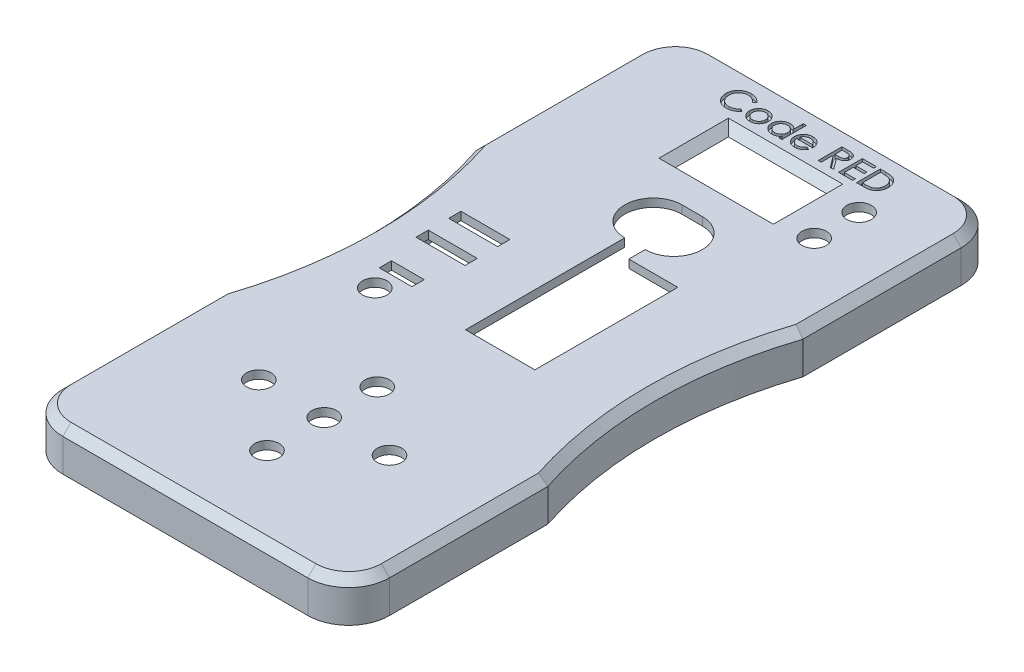
from build123d import *

# Parameters (mm, degrees)
SKETCH1_W           = 80
SKETCH1_H           = 160
BOSS_EXTRUDE1_DEPTH = 10
SKETCH2_R           = 100
CUT_EXTRUDE1_DEPTH  = 180.164728672
FILLET1_R           = 10
SHELL1_T            = -2
SKETCH3_R           = 4
BOSS_EXTRUDE2_DEPTH = 8
SKETCH4_R           = 2
BOSS_EXTRUDE3_DEPTH = 5
SKETCH5_R           = 3
CUT_EXTRUDE2_DEPTH  = 180.51323071
SKETCH7_R           = 3
SKETCH7_W           = 17
SKETCH7_H           = 35
SKETCH7_W_2         = 24
SKETCH7_H_2         = 13
SKETCH7_W_3         = 12
SKETCH7_H_3         = 3
SKETCH7_W_4         = 8
CUT_EXTRUDE3_DEPTH  = 180.51323071
CHAMFER1_SIZE       = 2
CHAMFER2_SIZE       = 2
CUT_EXTRUDE7_DEPTH  = 1
SKETCH14_R          = 3
CUT_EXTRUDE8_DEPTH  = 180.51323071
CUT_EXTRUDE9_REACH  = 181.165
SKETCH15_W          = 12
SKETCH15_H          = 8


with BuildPart() as part:
    # Sketch1 → Boss-Extrude1 (new body)
    with BuildSketch(Plane(origin=(0, 0, 0), x_dir=(1, 0, 0), z_dir=(0, 1, 0))):
        with Locations((40, 80)):
            Rectangle(SKETCH1_W, SKETCH1_H)
    extrude(amount=BOSS_EXTRUDE1_DEPTH)

    # Sketch2 → Cut-Extrude1 (cut, through all)
    with BuildSketch(Plane(origin=(0, 10, 0), x_dir=(1, 0, 0), z_dir=(0, 1, 0))):
        with Locations((-95, 80)):
            Circle(SKETCH2_R)
        with Locations((175, 80)):
            Circle(SKETCH2_R)
    extrude(amount=-CUT_EXTRUDE1_DEPTH, mode=Mode.SUBTRACT)

    # Fillet1
    fillet1_edges = [part.edges().sort_by_distance(p)[0] for p in [
        (0, 5, -160),
        (80, 5, -160),
        (80, 5, 0),
        (0, 5, 0),
    ]]
    fillet(fillet1_edges, radius=FILLET1_R)

    # Shell1
    shell1_openings = [part.faces().sort_by_distance(p)[0] for p in [
        (40, 0, -80),
    ]]
    offset(amount=SHELL1_T, openings=shell1_openings, kind=Kind.INTERSECTION)

    # Sketch3 → Boss-Extrude2 (add, through all)
    with BuildSketch(Plane.XZ.offset(-8)):
        with Locations(Location((70, -150, 0), (0, 0, 270))):
            Circle(SKETCH3_R)
        with Locations(Location((10, -150, 0), (0, 0, 90))):
            Circle(SKETCH3_R)
        with Locations(Location((10, -10, 0), (0, 0, 270))):
            Circle(SKETCH3_R)
        with Locations(Location((70, -10, 0), (0, 0, 90))):
            Circle(SKETCH3_R)
    extrude(amount=BOSS_EXTRUDE2_DEPTH)

    # Sketch4 → Boss-Extrude3 (add)
    with BuildSketch(Plane.XZ):
        with Locations(Location((70, -150, 0), (0, 0, 270))):
            Circle(SKETCH4_R)
        with Locations(Location((10, -150, 0), (0, 0, 90))):
            Circle(SKETCH4_R)
        with Locations(Location((10, -10, 0), (0, 0, 270))):
            Circle(SKETCH4_R)
        with Locations(Location((70, -10, 0), (0, 0, 90))):
            Circle(SKETCH4_R)
    extrude(amount=BOSS_EXTRUDE3_DEPTH)

    # Sketch5 → Cut-Extrude2 (cut, through all)
    with BuildSketch(Plane(origin=(0, 10, 0), x_dir=(1, 0, 0), z_dir=(0, 1, 0))):
        with Locations(Location((40, 47, 0), (0, 0, 270))):
            Circle(SKETCH5_R)
        with Locations(Location((24, 34, 0), (0, 0, 270))):
            Circle(SKETCH5_R)
        with Locations(Location((40, 20, 0), (0, 0, 270))):
            Circle(SKETCH5_R)
        with Locations(Location((56, 34, 0), (0, 0, 270))):
            Circle(SKETCH5_R)
        with Locations(Location((40, 34, 0), (0, 0, 270))):
            Circle(SKETCH5_R)
    extrude(amount=-CUT_EXTRUDE2_DEPTH, mode=Mode.SUBTRACT)

    # Sketch7 → Cut-Extrude3 (cut, through all)
    with BuildSketch(Plane(origin=(0, 10, 0), x_dir=(1, 0, 0), z_dir=(0, 1, 0))):
        with Locations(Location((18.7, 67.7, 0), (0, 0, 270))):
            Circle(SKETCH7_R)
        with Locations((47.19, 87.42)):
            Rectangle(SKETCH7_W, SKETCH7_H)
        with Locations((40, 138.5)):
            Rectangle(SKETCH7_W_2, SKETCH7_H_2)
        with Locations((19, 85)):
            Rectangle(SKETCH7_W_3, SKETCH7_H_3)
        with Locations((19, 93)):
            Rectangle(SKETCH7_W_3, SKETCH7_H_3)
        with Locations((19, 74)):
            Rectangle(SKETCH7_W_4, SKETCH7_H_3)
    extrude(amount=-CUT_EXTRUDE3_DEPTH, mode=Mode.SUBTRACT)

    # Chamfer1
    chamfer1_edges = [part.edges().sort_by_distance(p)[0] for p in [
        (52, 10, -138.5),
        (40, 10, -132),
        (28, 10, -138.5),
        (40, 10, -145),
    ]]
    chamfer(chamfer1_edges, length=CHAMFER1_SIZE - 0.0001)  # a hair under: the kernel refuses the full size

    # Chamfer2
    chamfer2_edges = [part.edges().sort_by_distance(p)[0] for p in [
        (0, 10, -29.387505004),
        (80, 10, -130.612494996),
        (5, 10, -80),
        (75, 10, -80),
        (80, 10, -29.387505004),
        (40, 10, 0),
        (0, 10, -130.612494996),
        (40, 10, -160),
        (77.071067812, 10, -157.071067812),
        (2.928932188, 10, -157.071067812),
        (2.928932188, 10, -2.928932188),
        (77.071067812, 10, -2.928932188),
    ]]
    chamfer(chamfer2_edges, length=CHAMFER2_SIZE)

    # Sketch13 → Cut-Extrude7 (cut)
    # profile 1 of 7: a face of its own
    with BuildSketch(Plane(origin=(0, 10, 0), x_dir=(1, 0, 0), z_dir=(0, 1, 0))):
        with BuildLine():
            Line((26.193963675, 153.738755342), (25.599287193, 153.328311966))
            add(Edge.make_bspline(
                [(25.599287193, 153.328311966), (25.528062162, 153.406328406), (25.388630662, 153.559054902), (25.159021422, 153.759117189), (24.918725731, 153.927500972), (24.66740523, 154.063645656), (24.404793831, 154.170225373), (24.129510174, 154.24428046), (23.841266656, 154.289918939), (23.644799324, 154.29557183), (23.544738248, 154.298450855)],
                knots=[0, 0, 0, 0, 1.078723025, 2.111729107, 3.104379151, 4.071093171, 5.02612831, 5.993405043, 6.978038489, 8, 8, 8, 8], degree=3))
            add(Edge.make_bspline(
                [(23.544738248, 154.298450855), (23.492610969, 154.297699506), (23.388908978, 154.296204772), (23.235234842, 154.279771223), (23.083911262, 154.257278281), (22.935080612, 154.223102576), (22.789007291, 154.178424225), (22.644696025, 154.126610921), (22.504332235, 154.062434982), (22.366554285, 153.991103828), (22.233429412, 153.910872088), (22.108037607, 153.821760448), (21.988097535, 153.727750735), (21.877000096, 153.624398163), (21.773731438, 153.513516606), (21.676029431, 153.396501414), (21.586363494, 153.271830551), (21.50507827, 153.139877771), (21.430933715, 153.00260913), (21.368710518, 152.859018576), (21.314689006, 152.711542005), (21.269858432, 152.559411486), (21.236701434, 152.402166218), (21.212115983, 152.240234224), (21.19636083, 152.073974182), (21.194802759, 151.961368517), (21.194017094, 151.904586505)],
                knots=[0, 0, 0, 0, 1.002068956, 1.993515617, 2.969284448, 3.943018425, 4.926742606, 5.905741285, 6.889351865, 7.892340394, 8.888397413, 9.875523532, 10.849114049, 11.817064186, 12.790109362, 13.76151668, 14.746886598, 15.740472426, 16.740336546, 17.744438579, 18.747064952, 19.759451636, 20.791569268, 21.834966327, 22.908270136, 24, 24, 24, 24], degree=3))
            add(Edge.make_bspline(
                [(21.194017094, 151.904586505), (21.195815801, 151.819350291), (21.199336826, 151.652497814), (21.233369471, 151.408183811), (21.286472412, 151.175361077), (21.361119129, 150.954047997), (21.45757153, 150.744495985), (21.575572883, 150.54704931), (21.715802202, 150.36122654), (21.875934798, 150.189429572), (22.050494454, 150.031764282), (22.2396856, 149.896867612), (22.437029697, 149.779727631), (22.646427088, 149.68671957), (22.864918821, 149.612748892), (23.094195898, 149.56035091), (23.333546111, 149.528201242), (23.496829514, 149.524341732), (23.579719217, 149.522382479)],
                knots=[0, 0, 0, 0, 1.083728652, 2.12143175, 3.131304262, 4.117911469, 5.086904967, 6.060353746, 7.03835, 8.042493243, 9.043967071, 10.025107856, 10.993520914, 11.958418665, 12.934074928, 13.923564625, 14.94591178, 16, 16, 16, 16], degree=3))
            add(Edge.make_bspline(
                [(23.579719217, 149.522382479), (23.675907104, 149.525209949), (23.865884359, 149.530794385), (24.145222271, 149.577832333), (24.414371359, 149.653806927), (24.673622222, 149.76090741), (24.923186463, 149.898081429), (25.161891676, 150.066383706), (25.391068223, 150.264292369), (25.530369152, 150.41528907), (25.601619257, 150.492521368)],
                knots=[0, 0, 0, 0, 0.996377973, 1.967910503, 2.926842387, 3.889624876, 4.868586907, 5.872161968, 6.91164629, 8, 8, 8, 8], degree=3))
            Line((25.601619257, 150.492521368), (26.193963675, 150.084410056))
            add(Edge.make_bspline(
                [(26.193963675, 150.084410056), (26.155617836, 150.035781041), (26.079429641, 149.93916151), (25.956391403, 149.802496932), (25.827155165, 149.673964436), (25.690448282, 149.55475624), (25.546417014, 149.444988292), (25.395736213, 149.343389595), (25.238550675, 149.250121746), (25.074946275, 149.166182775), (24.905855053, 149.091056315), (24.730931778, 149.027791039), (24.551852914, 148.9719807), (24.367039443, 148.928287383), (24.177212833, 148.892875179), (23.982079084, 148.869106306), (23.782491433, 148.853018596), (23.647770285, 148.851509929), (23.579719217, 148.850747863)],
                knots=[0, 0, 0, 0, 0.990136069, 1.967271632, 2.938597646, 3.903378639, 4.8655934, 5.832714132, 6.808088679, 7.786607084, 8.77175572, 9.76479442, 10.759640537, 11.769709565, 12.799869661, 13.846050076, 14.911985293, 16, 16, 16, 16], degree=3))
            add(Edge.make_bspline(
                [(23.579719217, 148.850747863), (23.517113544, 148.851172144), (23.393706408, 148.852008478), (23.211329218, 148.866060433), (23.033784929, 148.885061935), (22.861552108, 148.913568804), (22.693818044, 148.94770619), (22.53195184, 148.992968296), (22.373757426, 149.043457424), (22.221536542, 149.10451697), (22.074141449, 149.172418182), (21.93105363, 149.246836731), (21.793680783, 149.330803997), (21.661908557, 149.423504444), (21.534185896, 149.522604406), (21.411804571, 149.630310378), (21.29349124, 149.745250814), (21.220314619, 149.828169944), (21.183522803, 149.86986011)],
                knots=[0, 0, 0, 0, 1.116169561, 2.200172621, 3.260333751, 4.299600589, 5.312386579, 6.311224183, 7.295427787, 8.272379731, 9.233840239, 10.188782295, 11.146938977, 12.102635432, 13.060741968, 14.028403985, 15.00871894, 16, 16, 16, 16], degree=3))
            add(Edge.make_bspline(
                [(21.183522803, 149.86986011), (21.124544155, 149.942244924), (21.007638664, 150.085723669), (20.858640754, 150.318940777), (20.730126236, 150.561671503), (20.628016362, 150.817374153), (20.547306655, 151.083033095), (20.488480498, 151.359458954), (20.454585644, 151.647597291), (20.450058254, 151.843475819), (20.44775641, 151.943065572)],
                knots=[0, 0, 0, 0, 0.995996121, 1.974230005, 2.94855815, 3.923972302, 4.908363682, 5.909282248, 6.937024559, 8, 8, 8, 8], degree=3))
            add(Edge.make_bspline(
                [(20.44775641, 151.943065572), (20.450355088, 152.047761671), (20.455467825, 152.25374471), (20.49852657, 152.556120841), (20.568685488, 152.845372967), (20.665117072, 153.122749275), (20.792898801, 153.385980414), (20.945285619, 153.638467867), (21.129573913, 153.875507146), (21.336694952, 154.099150931), (21.564571457, 154.303824971), (21.810660881, 154.481310466), (22.069708031, 154.6329807), (22.342666904, 154.757226373), (22.630277114, 154.853477073), (22.932063187, 154.920063762), (23.247378053, 154.962226726), (23.462202786, 154.967434506), (23.571556991, 154.97008547)],
                knots=[0, 0, 0, 0, 1.034323922, 2.034967744, 3.011348252, 3.972313581, 4.931003742, 5.898099022, 6.881526582, 7.89265862, 8.907395938, 9.903191422, 10.886146247, 11.869423756, 12.861842533, 13.877618994, 14.91962492, 16, 16, 16, 16], degree=3))
            add(Edge.make_bspline(
                [(23.571556991, 154.97008547), (23.640380781, 154.969288558), (23.776645457, 154.967710746), (23.978673447, 154.952121229), (24.17557455, 154.926532483), (24.36738809, 154.89128521), (24.554681801, 154.847730118), (24.736464439, 154.790937976), (24.913766046, 154.726060206), (25.085393155, 154.651155523), (25.250924616, 154.567827635), (25.40848377, 154.473823101), (25.559159321, 154.372749847), (25.701750246, 154.262501178), (25.837206941, 154.144894877), (25.964867861, 154.018577297), (26.084067872, 153.883036146), (26.15720909, 153.78700997), (26.193963675, 153.738755342)],
                knots=[0, 0, 0, 0, 1.097463626, 2.172875475, 3.229307817, 4.262776093, 5.282168658, 6.293918414, 7.298043722, 8.291879901, 9.278790577, 10.251524626, 11.216027204, 12.170719329, 13.124142787, 14.075306658, 15.032812027, 16, 16, 16, 16], degree=3))
        make_face()
    # profile 2 of 7: a face of its own
    with BuildSketch(Plane(origin=(0, 10, 0), x_dir=(1, 0, 0), z_dir=(0, 1, 0))):
        with BuildLine():
            add(Edge.make_bspline(
                [(29.293277577, 153.402938034), (29.379658649, 153.400572499), (29.548776484, 153.395941229), (29.796240465, 153.363358048), (30.03123265, 153.306745871), (30.254426542, 153.229261781), (30.464903585, 153.127746813), (30.663189482, 153.004931233), (30.848575306, 152.858426945), (30.960244791, 152.746091387), (31.016673344, 152.689326255)],
                knots=[0, 0, 0, 0, 1.078775739, 2.112039281, 3.110494877, 4.093081892, 5.057110616, 6.022958758, 7.000966324, 8, 8, 8, 8], degree=3))
            add(Edge.make_bspline(
                [(31.016673344, 152.689326255), (31.066713987, 152.633061959), (31.165097793, 152.522441964), (31.292220324, 152.344006661), (31.400480753, 152.160452124), (31.488066347, 151.970394534), (31.557878393, 151.774702985), (31.606293552, 151.572604235), (31.636781761, 151.364480616), (31.640025168, 151.223730008), (31.641666667, 151.15249566)],
                knots=[0, 0, 0, 0, 1.062178036, 2.088324843, 3.086640365, 4.066023852, 5.037709567, 6.014384934, 6.995073642, 8, 8, 8, 8], degree=3))
            add(Edge.make_bspline(
                [(31.641666667, 151.15249566), (31.639615032, 151.080868246), (31.635548976, 150.938912669), (31.604075369, 150.72921402), (31.554299287, 150.525100916), (31.482695028, 150.327505197), (31.390542022, 150.136212465), (31.279986502, 149.9500591), (31.146692028, 149.771522754), (30.996822365, 149.600085779), (30.830274731, 149.441927819), (30.648516047, 149.303462034), (30.453774528, 149.186283127), (30.246401813, 149.089828716), (30.025408914, 149.016944511), (29.792936637, 148.962969202), (29.547191466, 148.931093297), (29.379269324, 148.927310881), (29.293277577, 148.925373932)],
                knots=[0, 0, 0, 0, 0.952871876, 1.888459614, 2.815544184, 3.744891397, 4.679563604, 5.637601804, 6.621431805, 7.640342292, 8.664856555, 9.672479278, 10.67487095, 11.683873433, 12.709444777, 13.765907845, 14.855937143, 16, 16, 16, 16], degree=3))
            add(Edge.make_bspline(
                [(29.293277577, 148.925373932), (29.211151639, 148.927260201), (29.050161023, 148.930957836), (28.814904495, 148.963784751), (28.590570072, 149.013882327), (28.37879376, 149.08841286), (28.177830959, 149.181614755), (27.989026015, 149.297213175), (27.810924677, 149.432457942), (27.648172898, 149.588936812), (27.49982937, 149.75715721), (27.37106956, 149.935745485), (27.26032399, 150.120549627), (27.170289437, 150.313132812), (27.101294665, 150.513425797), (27.050777203, 150.719775681), (27.021277084, 150.933987371), (27.017013625, 151.078946261), (27.014850427, 151.15249566)],
                knots=[0, 0, 0, 0, 1.108842573, 2.173652473, 3.202745058, 4.208988794, 5.200203338, 6.189803525, 7.193715926, 8.215010613, 9.234454675, 10.219573757, 11.184848795, 12.140854958, 13.08565054, 14.042002664, 15.006549187, 16, 16, 16, 16], degree=3))
            add(Edge.make_bspline(
                [(27.014850427, 151.15249566), (27.016612248, 151.225263696), (27.020083385, 151.368631128), (27.048537449, 151.580022777), (27.096815184, 151.783139196), (27.161897005, 151.979624183), (27.247837165, 152.167981669), (27.352318269, 152.349274501), (27.474395483, 152.524172047), (27.569556421, 152.631527446), (27.617689136, 152.685828158)],
                knots=[0, 0, 0, 0, 1.034079547, 2.037341334, 3.024980457, 3.998111168, 4.974764182, 5.962233312, 6.969290918, 8, 8, 8, 8], degree=3))
            add(Edge.make_bspline(
                [(27.617689136, 152.685828158), (27.673683935, 152.743028195), (27.784074463, 152.855794779), (27.967818163, 153.001996466), (28.161677306, 153.12665293), (28.367602244, 153.226890107), (28.5831897, 153.307427997), (28.8105579, 153.362934371), (29.048605078, 153.395931799), (29.21077235, 153.400575484), (29.293277577, 153.402938034)],
                knots=[0, 0, 0, 0, 1.021997278, 2.014808882, 2.992991082, 3.961403697, 4.935644248, 5.92819495, 6.945935601, 8, 8, 8, 8], degree=3))
        make_face()
        with BuildLine():
            add(Edge.make_bspline(
                [(29.290945513, 152.731303419), (29.241120281, 152.729975726), (29.142189623, 152.727339522), (28.996472865, 152.705767666), (28.854842633, 152.670883991), (28.718853086, 152.620238823), (28.586451586, 152.556947648), (28.459863287, 152.478115886), (28.336235238, 152.386942865), (28.220068092, 152.281366962), (28.111986156, 152.166432165), (28.018341899, 152.041789205), (27.938231855, 151.910932795), (27.874075425, 151.772211202), (27.823384334, 151.626566118), (27.78791502, 151.4737177), (27.764537019, 151.313737875), (27.762268731, 151.204663585), (27.761111111, 151.148997563)],
                knots=[0, 0, 0, 0, 0.976916649, 1.939720157, 2.882730922, 3.833047911, 4.780976627, 5.756404754, 6.753607, 7.790049989, 8.831165002, 9.84360893, 10.842529111, 11.835057585, 12.835634664, 13.861933882, 14.908838789, 16, 16, 16, 16], degree=3))
            add(Edge.make_bspline(
                [(27.761111111, 151.148997563), (27.763761627, 151.076498017), (27.768977912, 150.933816987), (27.811602508, 150.724825525), (27.879250021, 150.525092262), (27.973699971, 150.337223403), (28.089162117, 150.165345277), (28.223751279, 150.014875362), (28.372321332, 149.884615903), (28.537740618, 149.780012612), (28.71433755, 149.698140655), (28.899722014, 149.639855409), (29.092848652, 149.603428248), (29.224320611, 149.599167652), (29.290945513, 149.597008547)],
                knots=[0, 0, 0, 0, 1.073737222, 2.11314337, 3.147909503, 4.191315005, 5.220292011, 6.207728104, 7.175628903, 8.139268678, 9.098074859, 10.052770626, 11.013219503, 12, 12, 12, 12], degree=3))
            add(Edge.make_bspline(
                [(29.290945513, 149.597008547), (29.363017916, 149.599471085), (29.505040396, 149.604323646), (29.713051832, 149.642891197), (29.911702295, 149.704815836), (30.099599819, 149.791120708), (30.273978549, 149.900457178), (30.429909744, 150.033153964), (30.56657002, 150.187011173), (30.683585675, 150.358508828), (30.778080828, 150.544584669), (30.845923244, 150.739870761), (30.887073333, 150.942453611), (30.89260722, 151.079623755), (30.895405983, 151.148997563)],
                knots=[0, 0, 0, 0, 1.042880454, 2.055051067, 3.051726387, 4.048830532, 5.040201766, 6.022282375, 7.002717173, 8.011000956, 9.020163719, 10.014978664, 10.996075346, 12, 12, 12, 12], degree=3))
            add(Edge.make_bspline(
                [(30.895405983, 151.148997563), (30.894189888, 151.202714181), (30.891790977, 151.308677404), (30.868894613, 151.4645786), (30.831734254, 151.614698569), (30.778928646, 151.758366838), (30.712058387, 151.896083181), (30.629782771, 152.027260506), (30.53239329, 152.15252409), (30.421371403, 152.269846577), (30.301022786, 152.377719367), (30.173858836, 152.472983558), (30.040140522, 152.552103833), (29.9017212, 152.618779256), (29.75664833, 152.668324994), (29.606412826, 152.704622905), (29.45063098, 152.727735973), (29.344664023, 152.730103323), (29.290945513, 152.731303419)],
                knots=[0, 0, 0, 0, 1.02928639, 2.030405262, 3.013559112, 3.98951401, 4.959304921, 5.943474834, 6.952548865, 7.996299005, 9.035918103, 10.047849461, 11.03697177, 12.01024899, 12.98822153, 13.969594738, 14.97071361, 16, 16, 16, 16], degree=3))
        make_face(mode=Mode.SUBTRACT)
    # profile 3 of 7: a face of its own
    with BuildSketch(Plane(origin=(0, 10, 0), x_dir=(1, 0, 0), z_dir=(0, 1, 0))):
        with BuildLine():
            Line((37.089369658, 154.97008547), (37.089369658, 149))
            Line((37.089369658, 149), (36.343108974, 149))
            Line((36.343108974, 149), (36.343108974, 149.721774005))
            add(Edge.make_bspline(
                [(36.343108974, 149.721774005), (36.328959266, 149.690755022), (36.30060839, 149.628604246), (36.246636337, 149.540642532), (36.181592979, 149.458956767), (36.108126938, 149.381263402), (36.023558666, 149.310457634), (35.929738915, 149.244553047), (35.825348147, 149.185632984), (35.674274719, 149.112583032), (35.47285207, 149.037084269), (35.218534879, 148.973435507), (34.953382897, 148.93208706), (34.772230591, 148.927633073), (34.680346888, 148.925373932)],
                knots=[0, 0, 0, 0, 0.630608355, 1.263510136, 1.903889635, 2.560231196, 3.239051379, 3.941510257, 4.679392285, 5.454752425, 7.046003483, 8.649370513, 10.300500544, 12, 12, 12, 12], degree=3))
            add(Edge.make_bspline(
                [(34.680346888, 148.925373932), (34.602510788, 148.927414015), (34.449346255, 148.931428457), (34.223982724, 148.962493108), (34.007391201, 149.013344573), (33.799619658, 149.086853927), (33.599988101, 149.178438), (33.409507424, 149.291675755), (33.228068629, 149.42542013), (33.057539746, 149.57809125), (32.900726524, 149.744512047), (32.763396482, 149.92248937), (32.64753945, 150.109749595), (32.552178434, 150.305736783), (32.478591118, 150.51066246), (32.426082677, 150.724368776), (32.393703241, 150.947059082), (32.38987325, 151.098747918), (32.38792735, 151.175816306)],
                knots=[0, 0, 0, 0, 1.044896397, 2.056129067, 3.048614574, 4.027447711, 5.010571044, 5.993389545, 6.997607611, 8.032642259, 9.062836233, 10.063957202, 11.045957733, 12.014678412, 12.985421592, 13.963920723, 14.965531344, 16, 16, 16, 16], degree=3))
            add(Edge.make_bspline(
                [(32.38792735, 151.175816306), (32.38992875, 151.251319885), (32.393877244, 151.400278388), (32.425636638, 151.619355291), (32.48041297, 151.829451016), (32.553013025, 152.032278843), (32.650081186, 152.225582183), (32.766848771, 152.410675515), (32.906239584, 152.586274737), (33.062939406, 152.752673078), (33.235644021, 152.904334253), (33.418814318, 153.037974433), (33.611259378, 153.150319144), (33.811281387, 153.243294195), (34.020519032, 153.314557621), (34.237941781, 153.36593931), (34.464520859, 153.396850605), (34.618450966, 153.400886947), (34.696671341, 153.402938034)],
                knots=[0, 0, 0, 0, 1.016034841, 2.00450138, 2.971397661, 3.934621156, 4.89856897, 5.876820612, 6.875287917, 7.911527682, 8.949482881, 9.964547477, 10.958729259, 11.944200774, 12.928602415, 13.928548892, 14.947381472, 16, 16, 16, 16], degree=3))
            add(Edge.make_bspline(
                [(34.696671341, 153.402938034), (34.791279496, 153.39998076), (34.977286048, 153.394166543), (35.249372648, 153.349672822), (35.50660845, 153.27285309), (35.708730892, 153.186036319), (35.858177029, 153.102250834), (35.960021833, 153.034557194), (36.051488743, 152.962595634), (36.131641553, 152.884558785), (36.201859617, 152.802243679), (36.260614299, 152.714232075), (36.308053203, 152.62089307), (36.331365388, 152.555517022), (36.343108974, 152.522583634)],
                knots=[0, 0, 0, 0, 1.714476436, 3.370786067, 4.980251515, 6.570527442, 7.346543759, 8.083216037, 8.785213491, 9.452854217, 10.107771807, 10.742834115, 11.366698768, 12, 12, 12, 12], degree=3))
            Line((36.343108974, 152.522583634), (36.343108974, 154.97008547))
            Line((36.343108974, 154.97008547), (37.089369658, 154.97008547))
        make_face()
        with BuildLine():
            add(Edge.make_bspline(
                [(34.703667535, 152.731303419), (34.636238805, 152.729311107), (34.502263971, 152.725352562), (34.305403765, 152.685913682), (34.114834815, 152.625498794), (33.932888258, 152.540153944), (33.76277365, 152.432149067), (33.607700564, 152.30114564), (33.47132445, 152.146754536), (33.351560414, 151.974366714), (33.255077766, 151.786619156), (33.185741532, 151.588101562), (33.142026152, 151.381776778), (33.136813942, 151.240939755), (33.134188034, 151.169986144)],
                knots=[0, 0, 0, 0, 0.985345119, 1.9577923, 2.925239377, 3.9045943, 4.88888884, 5.865218326, 6.8639424, 7.89390404, 8.928923022, 9.941392206, 10.962874575, 12, 12, 12, 12], degree=3))
            add(Edge.make_bspline(
                [(33.134188034, 151.169986144), (33.136887797, 151.099441452), (33.142261228, 150.959033902), (33.185271531, 150.75220694), (33.258094252, 150.553332863), (33.354896027, 150.363230457), (33.475708447, 150.189052134), (33.612716957, 150.032676425), (33.768063458, 149.899956929), (33.938423519, 149.790799677), (34.119420097, 149.704153823), (34.307471359, 149.642201919), (34.501630802, 149.604727692), (34.632765216, 149.59959909), (34.699003405, 149.597008547)],
                knots=[0, 0, 0, 0, 1.031333656, 2.052699155, 3.074222885, 4.121835995, 5.16426796, 6.16712537, 7.155044458, 8.142292555, 9.118824853, 10.082511977, 11.031444683, 12, 12, 12, 12], degree=3))
            add(Edge.make_bspline(
                [(34.699003405, 149.597008547), (34.771450534, 149.599507154), (34.915816998, 149.604486166), (35.128899291, 149.643571184), (35.334853855, 149.710655099), (35.533072476, 149.798693588), (35.716078017, 149.91142651), (35.879901642, 150.042278976), (36.020578726, 150.19223729), (36.136975478, 150.359396568), (36.230440226, 150.54107441), (36.294748749, 150.735927038), (36.336635501, 150.941604502), (36.340919504, 151.082710957), (36.343108974, 151.154827724)],
                knots=[0, 0, 0, 0, 1.031892719, 2.056267863, 3.073853818, 4.112456973, 5.139224612, 6.127824176, 7.091682251, 8.058066784, 9.021542931, 9.991775944, 10.973635704, 12, 12, 12, 12], degree=3))
            add(Edge.make_bspline(
                [(36.343108974, 151.154827724), (36.341893371, 151.209705526), (36.339503485, 151.317595757), (36.316821293, 151.475894301), (36.279229342, 151.62689378), (36.228124661, 151.772039796), (36.159838723, 151.908925262), (36.078868742, 152.040496582), (35.981442323, 152.163689086), (35.871289998, 152.279493505), (35.750769586, 152.38555955), (35.621037934, 152.477485927), (35.484991216, 152.556328024), (35.342234712, 152.621131134), (35.191734834, 152.66952505), (35.035504907, 152.70619621), (34.871772336, 152.727428804), (34.760475154, 152.729994071), (34.703667535, 152.731303419)],
                knots=[0, 0, 0, 0, 1.037465343, 2.039665814, 3.016719567, 3.977036933, 4.943608494, 5.904404071, 6.894097402, 7.908064747, 8.923948958, 9.925502152, 10.910268881, 11.89404733, 12.884368405, 13.89545364, 14.925810466, 16, 16, 16, 16], degree=3))
        make_face(mode=Mode.SUBTRACT)
    # profile 4 of 7: a face of its own
    with BuildSketch(Plane(origin=(0, 10, 0), x_dir=(1, 0, 0), z_dir=(0, 1, 0))):
        with BuildLine():
            Line((41.766325287, 150.492521368), (42.387820513, 150.195183126))
            add(Edge.make_bspline(
                [(42.387820513, 150.195183126), (42.34852887, 150.123775512), (42.272011892, 149.984715537), (42.141445735, 149.792689643), (41.999748427, 149.623813613), (41.848297224, 149.476218417), (41.685202644, 149.34993889), (41.513400163, 149.237908085), (41.329245866, 149.143970838), (41.135103295, 149.063676388), (40.928423976, 149.001886827), (40.709462363, 148.957990632), (40.477771014, 148.93064632), (40.318967715, 148.927159342), (40.237656918, 148.925373932)],
                knots=[0, 0, 0, 0, 1.110387997, 2.162381809, 3.158716456, 4.110235088, 5.03849693, 5.965639636, 6.901458115, 7.851707839, 8.825366416, 9.836184406, 10.892078622, 12, 12, 12, 12], degree=3))
            add(Edge.make_bspline(
                [(40.237656918, 148.925373932), (40.151639945, 148.927146034), (39.983617807, 148.930607587), (39.739389693, 148.964633602), (39.508937731, 149.016123775), (39.293096735, 149.090697739), (39.092699816, 149.188643132), (38.905355763, 149.305592613), (38.733266372, 149.445180934), (38.578075001, 149.60505751), (38.440218251, 149.777726159), (38.317010613, 149.956384308), (38.216235748, 150.142824437), (38.1311212, 150.333448054), (38.065602767, 150.530311092), (38.019182397, 150.732550541), (37.990031591, 150.940594937), (37.986613195, 151.081271702), (37.984882479, 151.15249566)],
                knots=[0, 0, 0, 0, 1.164566152, 2.274817246, 3.333639364, 4.359360714, 5.360157823, 6.349126428, 7.344925074, 8.35392925, 9.361228562, 10.335284257, 11.289572886, 12.22779236, 13.160187688, 14.095091993, 15.035554391, 16, 16, 16, 16], degree=3))
            add(Edge.make_bspline(
                [(37.984882479, 151.15249566), (37.986397825, 151.219040504), (37.989403478, 151.35103058), (38.015038829, 151.545960515), (38.054118546, 151.735727964), (38.11041201, 151.919557047), (38.183267298, 152.097771313), (38.272137764, 152.270618642), (38.377084059, 152.438050703), (38.458173461, 152.543047381), (38.499102731, 152.59604367)],
                knots=[0, 0, 0, 0, 1.021096707, 2.025320431, 3.012923591, 3.992437812, 4.971861174, 5.964497656, 6.972595394, 8, 8, 8, 8], degree=3))
            add(Edge.make_bspline(
                [(38.499102731, 152.59604367), (38.554451713, 152.660344823), (38.663546644, 152.787084819), (38.849465787, 152.951931314), (39.048711122, 153.092190144), (39.262595433, 153.205411278), (39.489532932, 153.295370058), (39.730819526, 153.357567618), (39.985742347, 153.395729912), (40.16017358, 153.400500175), (40.249317241, 153.402938034)],
                knots=[0, 0, 0, 0, 1.018725525, 2.007946416, 2.977291296, 3.940674949, 4.909614547, 5.904411593, 6.929042575, 8, 8, 8, 8], degree=3))
            add(Edge.make_bspline(
                [(40.249317241, 153.402938034), (40.345471182, 153.400722464), (40.533198892, 153.396396861), (40.806307638, 153.355459974), (41.06390709, 153.290797464), (41.305350467, 153.1982171), (41.531125897, 153.079498023), (41.74117315, 152.935124971), (41.935893283, 152.764250529), (42.048528031, 152.631747754), (42.105640692, 152.564560797)],
                knots=[0, 0, 0, 0, 1.092510559, 2.132980742, 3.131821249, 4.106721871, 5.065344059, 6.025034973, 6.998572742, 8, 8, 8, 8], degree=3))
            add(Edge.make_bspline(
                [(42.105640692, 152.564560797), (42.145628942, 152.512473553), (42.225349223, 152.408632808), (42.32522262, 152.238481267), (42.412085427, 152.059782502), (42.483642379, 151.870209747), (42.537449956, 151.669989336), (42.579069923, 151.460553841), (42.603069304, 151.240874126), (42.608014789, 151.091138705), (42.610532686, 151.014903846)],
                knots=[0, 0, 0, 0, 0.947891001, 1.889708495, 2.844047414, 3.816063809, 4.811874475, 5.836031954, 6.898258033, 8, 8, 8, 8], degree=3))
            Line((42.610532686, 151.014903846), (38.72997713, 151.014903846))
            add(Edge.make_bspline(
                [(38.72997713, 151.014903846), (38.731979038, 150.965433803), (38.735910329, 150.868285874), (38.760683074, 150.726407093), (38.795056994, 150.59030713), (38.843226563, 150.460197188), (38.904206512, 150.335995113), (38.977755523, 150.217782329), (39.06498611, 150.106456983), (39.163442124, 150.002331291), (39.27086655, 149.907593421), (39.384365206, 149.82435661), (39.503083447, 149.753224515), (39.627762981, 149.696772368), (39.757204727, 149.651470801), (39.891807811, 149.620882285), (40.031366837, 149.59952952), (40.126411606, 149.59785775), (40.174691173, 149.597008547)],
                knots=[0, 0, 0, 0, 1.056285998, 2.074305788, 3.068874036, 4.051103373, 5.031155672, 6.019259974, 7.018838325, 8.046424154, 9.075617995, 10.073437039, 11.048590896, 12.025474346, 12.991505956, 13.972050267, 14.969869311, 16, 16, 16, 16], degree=3))
            add(Edge.make_bspline(
                [(40.174691173, 149.597008547), (40.226452094, 149.597981815), (40.329538181, 149.599920158), (40.482158366, 149.620035534), (40.632595479, 149.648229652), (40.778314103, 149.690955051), (40.9182112, 149.740966002), (41.047917445, 149.800659672), (41.166294805, 149.867047436), (41.277879757, 149.943848222), (41.389046366, 150.040139227), (41.506162907, 150.163960519), (41.633958688, 150.317419899), (41.720190615, 150.431492007), (41.766325287, 150.492521368)],
                knots=[0, 0, 0, 0, 0.974501181, 1.940798391, 2.895710587, 3.855187413, 4.797895034, 5.692306932, 6.541458453, 7.351844759, 8.239729442, 9.306468335, 10.558942083, 12, 12, 12, 12], degree=3))
        make_face()
        with BuildLine():
            add(Edge.make_bspline(
                [(41.865438034, 151.686538462), (41.846527844, 151.734746945), (41.808812815, 151.830895339), (41.736201299, 151.967388099), (41.650225719, 152.094857429), (41.553291004, 152.215247041), (41.440452176, 152.326011695), (41.309887748, 152.4248644), (41.163037215, 152.514496978), (40.999858458, 152.589657467), (40.826798218, 152.652363806), (40.647290544, 152.698318116), (40.463159724, 152.725721162), (40.338804164, 152.729432908), (40.276135984, 152.731303419)],
                knots=[0, 0, 0, 0, 0.917468198, 1.829825112, 2.733739057, 3.639830069, 4.565591991, 5.528900948, 6.536885056, 7.609579627, 8.708054817, 9.795976896, 10.889296829, 12, 12, 12, 12], degree=3))
            add(Edge.make_bspline(
                [(40.276135984, 152.731303419), (40.228285744, 152.730096261), (40.133474496, 152.727704379), (39.993369411, 152.711268347), (39.857544916, 152.683351012), (39.726064254, 152.643385575), (39.599025871, 152.591916657), (39.475708453, 152.529676813), (39.356573834, 152.456485609), (39.281833484, 152.399629687), (39.244197382, 152.370999432)],
                knots=[0, 0, 0, 0, 1.030056501, 2.040970785, 3.032161429, 4.011555994, 4.995123754, 5.979296403, 6.982458509, 8, 8, 8, 8], degree=3))
            add(Edge.make_bspline(
                [(39.244197382, 152.370999432), (39.196408415, 152.32893125), (39.098605137, 152.242835934), (38.977192991, 152.081227957), (38.867970125, 151.895945222), (38.813237517, 151.758170846), (38.784780649, 151.686538462)],
                knots=[0, 0, 0, 0, 0.913853049, 1.870260628, 2.892694598, 4, 4, 4, 4], degree=3))
            Line((38.784780649, 151.686538462), (41.865438034, 151.686538462))
        make_face(mode=Mode.SUBTRACT)
    # profile 5 of 7: a face of its own
    with BuildSketch(Plane(origin=(0, 10, 0), x_dir=(1, 0, 0), z_dir=(0, 1, 0))):
        with BuildLine():
            Line((45.969871795, 154.820833333), (47.161556824, 154.820833333))
            add(Edge.make_bspline(
                [(47.161556824, 154.820833333), (47.238128722, 154.820648189), (47.384673606, 154.820293855), (47.594953903, 154.816575611), (47.785882817, 154.811651126), (47.95760465, 154.801364589), (48.110579251, 154.792284814), (48.244144983, 154.777351127), (48.358930682, 154.764031894), (48.427943397, 154.749378065), (48.459350795, 154.742709168)],
                knots=[0, 0, 0, 0, 1.411347063, 2.701065231, 3.876524531, 4.931206492, 5.871916627, 6.700262025, 7.408494688, 8, 8, 8, 8], degree=3))
            add(Edge.make_bspline(
                [(48.459350795, 154.742709168), (48.506181617, 154.730936491), (48.598445471, 154.707742523), (48.731369874, 154.662078516), (48.856862409, 154.608243928), (48.974757675, 154.546534851), (49.08533914, 154.47664133), (49.186467423, 154.396454839), (49.282126374, 154.31007138), (49.368625004, 154.214780766), (49.447325675, 154.113450448), (49.514616809, 154.006098287), (49.572353195, 153.894166024), (49.62054071, 153.777820049), (49.656571309, 153.655762934), (49.681808657, 153.528893002), (49.699177218, 153.397587051), (49.700504971, 153.308157655), (49.701175214, 153.263014156)],
                knots=[0, 0, 0, 0, 1.103820101, 2.174693741, 3.209859002, 4.223626675, 5.214778413, 6.196198804, 7.171320727, 8.158999421, 9.134971582, 10.10159085, 11.051641808, 12.012235658, 12.97676874, 13.956376421, 14.968389326, 16, 16, 16, 16], degree=3))
            add(Edge.make_bspline(
                [(49.701175214, 153.263014156), (49.698680146, 153.188562463), (49.693776494, 153.042239733), (49.649212021, 152.828838981), (49.57618338, 152.627677519), (49.492886645, 152.470535004), (49.411853899, 152.35370915), (49.344011719, 152.27065493), (49.26942661, 152.192845945), (49.188627427, 152.119472127), (49.099487814, 152.053775919), (49.004727106, 151.991485632), (48.90322747, 151.93422329), (48.756921182, 151.865465648), (48.559033355, 151.793800793), (48.303347161, 151.732362397), (48.027058865, 151.695042832), (47.836030528, 151.689430824), (47.73757679, 151.686538462)],
                knots=[0, 0, 0, 0, 1.258986715, 2.474334223, 3.670931197, 4.871716255, 5.472099774, 6.075216246, 6.684756624, 7.295006596, 7.919971941, 8.55677058, 9.213641309, 9.890468445, 11.291088691, 12.766994829, 14.333747493, 16, 16, 16, 16], degree=3))
            Line((47.73757679, 151.686538462), (49.775801282, 149))
            Line((49.775801282, 149), (48.953748498, 149))
            Line((48.953748498, 149), (46.915524005, 151.686538462))
            Line((46.915524005, 151.686538462), (46.716132479, 151.686538462))
            Line((46.716132479, 151.686538462), (46.716132479, 149))
            Line((46.716132479, 149), (45.969871795, 149))
            Line((45.969871795, 149), (45.969871795, 154.820833333))
        make_face()
        with BuildLine():
            Line((46.716132479, 154.149198718), (46.716132479, 152.357007045))
            Line((46.716132479, 152.357007045), (47.5720002, 152.351176883))
            add(Edge.make_bspline(
                [(47.5720002, 152.351176883), (47.617868435, 152.351295397), (47.706521919, 152.351524459), (47.8348463, 152.356241154), (47.953870262, 152.364139395), (48.06312365, 152.37583716), (48.162289575, 152.389792987), (48.252128175, 152.40542363), (48.331795883, 152.426529989), (48.424857771, 152.456954039), (48.528250701, 152.505833152), (48.637931438, 152.580253632), (48.734070475, 152.668328445), (48.812909464, 152.771529212), (48.875989086, 152.884751818), (48.921878068, 153.005639485), (48.949521246, 153.133510813), (48.953096306, 153.220900883), (48.95491453, 153.265346221)],
                knots=[0, 0, 0, 0, 1.165824803, 2.253289887, 3.263370799, 4.197285623, 5.045371766, 5.808848116, 6.513348392, 7.138183875, 8.296069948, 9.40583476, 10.496436725, 11.595152671, 12.691956992, 13.780050175, 14.870965332, 16, 16, 16, 16], degree=3))
            add(Edge.make_bspline(
                [(48.95491453, 153.265346221), (48.953010289, 153.308220063), (48.949233299, 153.393258718), (48.922369722, 153.518063788), (48.874351896, 153.635805247), (48.810643169, 153.746331746), (48.731704976, 153.845694015), (48.640924252, 153.933249316), (48.536053686, 154.002649079), (48.439504457, 154.049489253), (48.352975152, 154.078865653), (48.276357075, 154.097007281), (48.189148195, 154.113025873), (48.091170326, 154.127104866), (47.982604545, 154.137391125), (47.863180039, 154.143862519), (47.732955744, 154.148947192), (47.642356564, 154.149112761), (47.595320847, 154.149198718)],
                knots=[0, 0, 0, 0, 1.114111647, 2.20979856, 3.297775031, 4.406653707, 5.514151176, 6.585969385, 7.670234779, 8.768154562, 9.365517569, 10.041721951, 10.812428959, 11.669578816, 12.61341719, 13.645562296, 14.777663698, 16, 16, 16, 16], degree=3))
            Line((47.595320847, 154.149198718), (46.716132479, 154.149198718))
        make_face(mode=Mode.SUBTRACT)
    # profile 6 of 7: a face of its own
    with BuildSketch(Plane(origin=(0, 10, 0), x_dir=(1, 0, 0), z_dir=(0, 1, 0))):
        Polygon((50.969818376, 154.820833333), (54.402617521, 154.820833333), (54.402617521, 154.149198718), (51.71607906, 154.149198718), (51.71607906, 152.507425214), (54.402617521, 152.507425214), (54.402617521, 151.835790598), (51.71607906, 151.835790598), (51.71607906, 149.671634615), (54.402617521, 149.671634615), (54.402617521, 149), (50.969818376, 149), align=None)
    # profile 7 of 7: a face of its own
    with BuildSketch(Plane(origin=(0, 10, 0), x_dir=(1, 0, 0), z_dir=(0, 1, 0))):
        with BuildLine():
            Line((55.37275641, 149), (55.37275641, 154.820833333))
            Line((55.37275641, 154.820833333), (56.605252571, 154.820833333))
            add(Edge.make_bspline(
                [(56.605252571, 154.820833333), (56.709036657, 154.820109932), (56.908875023, 154.818717007), (57.197771286, 154.80958225), (57.464198948, 154.793874871), (57.708728911, 154.7701989), (57.931115503, 154.742353875), (58.131288062, 154.705515402), (58.310011641, 154.665803709), (58.419450507, 154.629283764), (58.47090428, 154.612113548)],
                knots=[0, 0, 0, 0, 1.321377177, 2.544338591, 3.679698859, 4.71869479, 5.671952218, 6.531967125, 7.309789724, 8, 8, 8, 8], degree=3))
            add(Edge.make_bspline(
                [(58.47090428, 154.612113548), (58.54294521, 154.58496763), (58.685135252, 154.531388653), (58.886599315, 154.430814008), (59.076934318, 154.320472888), (59.253768749, 154.195222522), (59.416764925, 154.05585193), (59.568720123, 153.905405162), (59.704945746, 153.739495838), (59.829729137, 153.562806305), (59.940292412, 153.375132226), (60.035994509, 153.178938721), (60.116823061, 152.974602515), (60.183297886, 152.762643761), (60.234243353, 152.542680902), (60.271889353, 152.315312366), (60.294383724, 152.079949816), (60.296835526, 151.920182244), (60.298076923, 151.839288695)],
                knots=[0, 0, 0, 0, 1.037989101, 2.048720264, 3.03347809, 4.003905725, 4.967380877, 5.923996735, 6.884742632, 7.859453364, 8.839691521, 9.819957728, 10.801471334, 11.80152298, 12.813966534, 13.844978706, 14.908869198, 16, 16, 16, 16], degree=3))
            add(Edge.make_bspline(
                [(60.298076923, 151.839288695), (60.296992391, 151.769288579), (60.294849994, 151.631009587), (60.276727541, 151.426213538), (60.248047056, 151.227165167), (60.207051293, 151.033992082), (60.154633206, 150.846967734), (60.090054406, 150.665566892), (60.01477058, 150.489558325), (59.927001579, 150.320946925), (59.830793095, 150.160239457), (59.725609691, 150.009750592), (59.613547028, 149.86942973), (59.494347369, 149.739262873), (59.366902196, 149.619939592), (59.231378634, 149.51155116), (59.088577826, 149.412988318), (58.937118965, 149.324931095), (58.774171712, 149.246641095), (58.596732493, 149.180930225), (58.404450395, 149.125347816), (58.197517788, 149.078090004), (57.974847619, 149.044446738), (57.737542363, 149.018984189), (57.485467882, 149.001845569), (57.312286123, 149.000626665), (57.2232497, 149)],
                knots=[0, 0, 0, 0, 1.058131973, 2.090245403, 3.105765157, 4.096918797, 5.07359586, 6.040054961, 7.006085223, 7.965371986, 8.911666288, 9.835956746, 10.738988486, 11.624821356, 12.502036588, 13.375701924, 14.24610047, 15.122941669, 16.021834204, 16.975760622, 17.979893693, 19.046217526, 20.182340398, 21.382202726, 22.654134781, 24, 24, 24, 24], degree=3))
            Line((57.2232497, 149), (55.37275641, 149))
        make_face()
        with BuildLine():
            Line((56.119017094, 149.671634615), (56.62507512, 149.671634615))
            add(Edge.make_bspline(
                [(56.62507512, 149.671634615), (56.718365038, 149.671993923), (56.897588092, 149.672684203), (57.155288538, 149.680335796), (57.390617815, 149.689471647), (57.602820995, 149.706433906), (57.792363035, 149.725364328), (57.95924788, 149.749824825), (58.104157812, 149.777331587), (58.19160099, 149.80316197), (58.231867655, 149.815056591)],
                knots=[0, 0, 0, 0, 1.383618687, 2.658126108, 3.823786659, 4.876093986, 5.815132222, 6.648351516, 7.377580062, 8, 8, 8, 8], degree=3))
            add(Edge.make_bspline(
                [(58.231867655, 149.815056591), (58.281920144, 149.832951313), (58.380789905, 149.868299143), (58.522458261, 149.934075871), (58.655975878, 150.009949677), (58.780894972, 150.096604034), (58.898270693, 150.192899558), (59.008196447, 150.298727343), (59.108717532, 150.416263434), (59.200455281, 150.543171041), (59.283579667, 150.678585811), (59.355828108, 150.822064472), (59.416939795, 150.973316523), (59.465183988, 151.13197631), (59.504173334, 151.297842361), (59.531916505, 151.471216629), (59.548290178, 151.652407677), (59.550627487, 151.775511966), (59.551816239, 151.838122663)],
                knots=[0, 0, 0, 0, 0.982760408, 1.941267819, 2.884666843, 3.819923004, 4.749609063, 5.690155114, 6.638335438, 7.60609908, 8.583824457, 9.574050268, 10.573936541, 11.597196452, 12.638231748, 13.723193679, 14.842018967, 16, 16, 16, 16], degree=3))
            add(Edge.make_bspline(
                [(59.551816239, 151.838122663), (59.550879345, 151.903863501), (59.549034874, 152.033288055), (59.529017002, 152.223594058), (59.501039451, 152.406973946), (59.458901414, 152.582884572), (59.403377529, 152.750780309), (59.338946835, 152.91256206), (59.259882693, 153.065736939), (59.170462377, 153.211296507), (59.070561034, 153.347723465), (58.960135731, 153.472934717), (58.841223706, 153.588262147), (58.710944156, 153.690227468), (58.572992561, 153.783689569), (58.424532838, 153.863396844), (58.267185036, 153.933376767), (58.157200981, 153.969776377), (58.101272035, 153.988286258)],
                knots=[0, 0, 0, 0, 1.129217777, 2.223100788, 3.284889252, 4.31516385, 5.326848226, 6.321524555, 7.304244934, 8.284784113, 9.254596696, 10.205833222, 11.15055266, 12.096616828, 13.045035565, 14.010353181, 14.988227444, 16, 16, 16, 16], degree=3))
            add(Edge.make_bspline(
                [(58.101272035, 153.988286258), (58.053991261, 154.00129219), (57.953557358, 154.028919412), (57.789857981, 154.060819022), (57.605393066, 154.088164173), (57.399309558, 154.111600576), (57.172544587, 154.128702866), (56.924041595, 154.139418502), (56.654678524, 154.148420607), (56.467669554, 154.148933343), (56.370880075, 154.149198718)],
                knots=[0, 0, 0, 0, 0.675026783, 1.433893058, 2.294494921, 3.24250292, 4.28921909, 5.425097092, 6.667317884, 8, 8, 8, 8], degree=3))
            Line((56.370880075, 154.149198718), (56.119017094, 154.149198718))
            Line((56.119017094, 154.149198718), (56.119017094, 149.671634615))
        make_face(mode=Mode.SUBTRACT)
    extrude(amount=-CUT_EXTRUDE7_DEPTH, mode=Mode.SUBTRACT)

    # Sketch14 → Cut-Extrude8 (cut, through all)
    with BuildSketch(Plane(origin=(0, 10, 0), x_dir=(1, 0, 0), z_dir=(0, 1, 0))):
        with Locations(Location((62, 143, 0), (0, 0, 270))):
            Circle(SKETCH14_R)
        with Locations(Location((62, 132, 0), (0, 0, 270))):
            Circle(SKETCH14_R)
        with BuildLine():
            Line((38.69, 122.92), (43.69, 122.92))
            ThreePointArc((43.69, 122.92), (50.69, 115.92), (43.69, 108.92))
            Line((43.69, 108.92), (43.69, 104.92))
            Line((43.69, 104.92), (38.69, 104.92))
            Line((38.69, 104.92), (38.69, 108.92))
            ThreePointArc((38.69, 108.92), (31.69, 115.92), (38.69, 122.92))
        make_face()
    extrude(amount=-CUT_EXTRUDE8_DEPTH, mode=Mode.SUBTRACT)

    # Sketch15 → Cut-Extrude9 (cut, up to next)
    with BuildSketch(Plane.ZY, mode=Mode.PRIVATE) as cut_extrude9_sk1:
        with Locations((-136, 4)):
            Rectangle(SKETCH15_W, SKETCH15_H)
    cut_extrude9_tool1 = extrude(cut_extrude9_sk1.sketch, amount=-CUT_EXTRUDE9_REACH, mode=Mode.PRIVATE) & part.part
    add(cut_extrude9_tool1.solids().sort_by_distance((0, 4, -136))[0], mode=Mode.SUBTRACT)


solid = part.part
